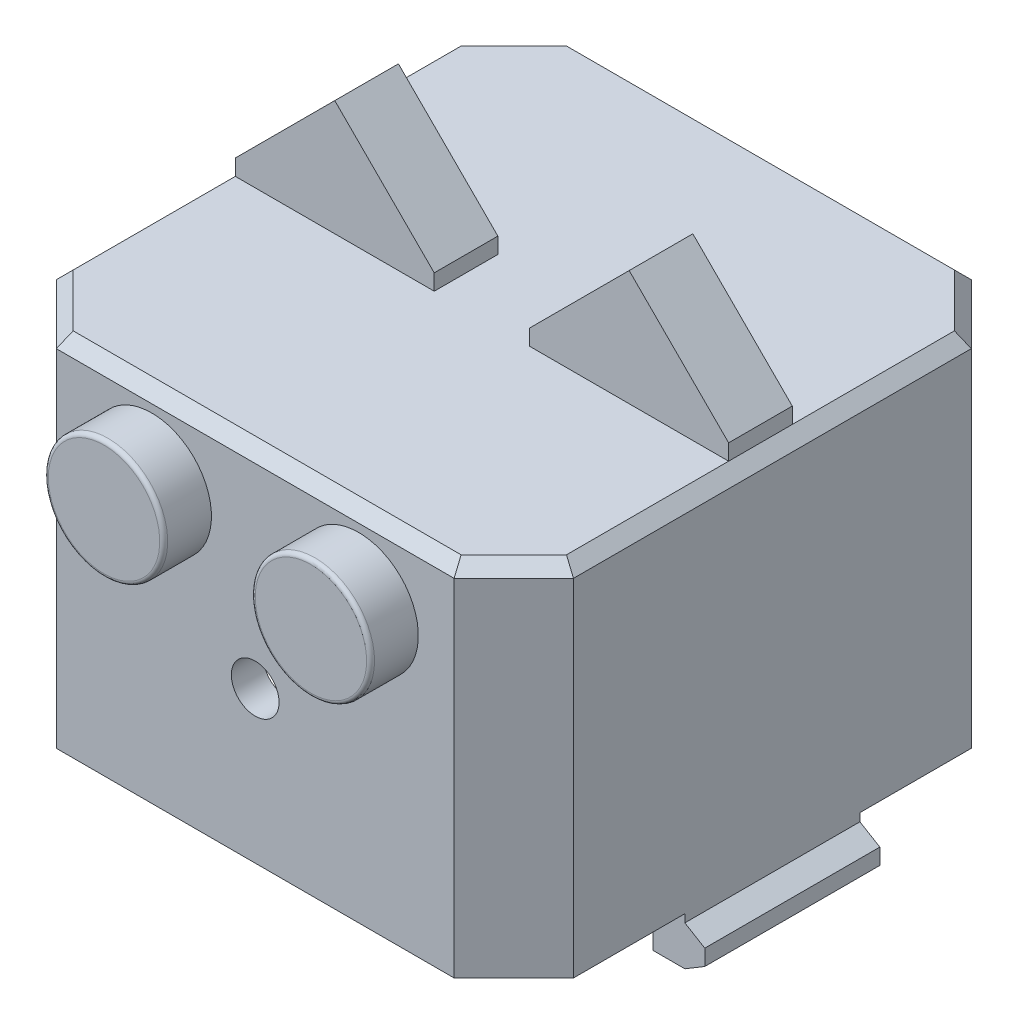
from build123d import *

# Parameters (mm, degrees)
SALIENTE_EXTRUIR1_DEPTH  = 45
VACIADO2_T               = -4
CHAFL_N3_SIZE            = 1.5
CROQUIS2_R               = 7.5
SALIENTE_EXTRUIR2_DEPTH  = 6
CROQUIS4_R               = 5
CORTAR_EXTRUIR2_DEPTH    = 5.5
REDONDEO1_R              = 0.5
CROQUIS5_R               = 3
CORTAR_EXTRUIR3_DEPTH    = 10
SALIENTE_EXTRUIR8_START  = 5.5
CROQUIS13_R              = 5
CROQUIS13_R_2            = 2.6
SALIENTE_EXTRUIR8_DEPTH  = 5.5
CROQUIS7_W               = 4
CROQUIS7_H               = 4
SALIENTE_EXTRUIR3_DEPTH  = 1
CROQUIS8_R               = 2
SALIENTE_EXTRUIR4_DEPTH  = 1
CROQUIS9_R               = 1.6
CORTAR_EXTRUIR5_DEPTH    = 2
CROQUIS10_W              = 25
CROQUIS10_H              = 8
SALIENTE_EXTRUIR5_DEPTH  = 2
SALIENTE_EXTRUIR6_DEPTH  = 8
CROQUIS12_R              = 1.15
CROQUIS12_R_2            = 0.8
SALIENTE_EXTRUIR7_DEPTH  = 6
CROQUIS14_W              = 3
CROQUIS14_H              = 2.5
SALIENTE_EXTRUIR9_DEPTH  = 5
CROQUIS15_W              = 12
CROQUIS15_H              = 8
CORTAR_EXTRUIR6_DEPTH    = 2
CROQUIS16_W              = 14.5
CROQUIS16_H              = 14.5
CROQUIS16_W_2            = 12.4
CROQUIS16_H_2            = 12.4
SALIENTE_EXTRUIR10_DEPTH = 3
CROQUIS17_R              = 5.5
CORTAR_EXTRUIR7_DEPTH    = 96.317889192
CROQUIS18_W              = 4
CROQUIS18_H              = 22
SALIENTE_EXTRUIR11_DEPTH = 6
SALIENTE_EXTRUIR13_DEPTH = 22


with BuildPart() as part:
    # Croquis1 → Saliente-Extruir1 (new body)
    with BuildSketch(Plane(origin=(0, 0, 0), x_dir=(1, 0, 0), z_dir=(0, 1, 0))):
        Polygon((-25, -32.5), (25, -32.5), (32.5, -25), (32.5, 25), (25, 32.5), (-25, 32.5), (-32.5, 25), (-32.5, -25), align=None)
    extrude(amount=SALIENTE_EXTRUIR1_DEPTH)

    # Vaciado2
    vaciado2_openings = [part.faces().sort_by_distance(p)[0] for p in [
        (0, 0, 0),
    ]]
    offset(amount=VACIADO2_T, openings=vaciado2_openings, kind=Kind.INTERSECTION)

    # Chaflán3
    chafl_n3_edges = [part.edges().sort_by_distance(p)[0] for p in [
        (0, 45, -32.5),
        (32.5, 45, 0),
        (0, 45, 32.5),
        (-32.5, 45, 0),
        (-28.75, 45, 28.75),
        (28.75, 45, 28.75),
        (28.75, 45, -28.75),
        (-28.75, 45, -28.75),
    ]]
    chamfer(chafl_n3_edges, length=CHAFL_N3_SIZE)

    # Croquis2 → Saliente-Extruir2 (add)
    with BuildSketch(Plane.XY.offset(32.5)):
        with Locations((13, 35)):
            Circle(CROQUIS2_R)
        with Locations((-13, 35)):
            Circle(CROQUIS2_R)
    extrude(amount=SALIENTE_EXTRUIR2_DEPTH)

    # Croquis4 → Cortar-Extruir2 (cut)
    with BuildSketch(Plane(origin=(0, 0, 28.5), x_dir=(-1, 0, 0), z_dir=(0, 0, -1))):
        with Locations((-13, 35)):
            Circle(CROQUIS4_R)
        with Locations((13, 35)):
            Circle(CROQUIS4_R)
    extrude(amount=-CORTAR_EXTRUIR2_DEPTH, mode=Mode.SUBTRACT)

    # Redondeo1
    redondeo1_edges = [part.edges().sort_by_distance(p)[0] for p in [
        (-20.5, 35, 38.5),
        (5.5, 35, 38.5),
    ]]
    fillet(redondeo1_edges, radius=REDONDEO1_R)

    # Croquis5 → Cortar-Extruir3 (cut)
    with BuildSketch(Plane.XY.offset(32.5)):
        with Locations((0, 19)):
            Circle(CROQUIS5_R)
    extrude(amount=-CORTAR_EXTRUIR3_DEPTH, mode=Mode.SUBTRACT)

    # Croquis13 → Saliente-Extruir8 (add)
    # profile 1 of 2: a face of its own
    with BuildSketch(Plane(origin=(0, 0, 34), x_dir=(-1, 0, 0), z_dir=(0, 0, -1)).offset(SALIENTE_EXTRUIR8_START)):
        with Locations((13, 35)):
            Circle(CROQUIS13_R)
        with Locations((13, 35)):
            Circle(CROQUIS13_R_2, mode=Mode.SUBTRACT)
    # profile 2 of 2: a face of its own
    with BuildSketch(Plane(origin=(0, 0, 34), x_dir=(-1, 0, 0), z_dir=(0, 0, -1)).offset(SALIENTE_EXTRUIR8_START)):
        with Locations((-13, 35)):
            Circle(CROQUIS13_R)
        with Locations((-13, 35)):
            Circle(CROQUIS13_R_2, mode=Mode.SUBTRACT)
    extrude(amount=-SALIENTE_EXTRUIR8_DEPTH)

    # Croquis7 → Saliente-Extruir3 (add)
    with BuildSketch(Plane(origin=(0, 0, 28.5), x_dir=(-1, 0, 0), z_dir=(0, 0, -1))):
        with Locations((-11.58, 10.5)):
            Rectangle(CROQUIS7_W, CROQUIS7_H)
        with Locations((-11.58, 28)):
            Rectangle(CROQUIS7_W, CROQUIS7_H)
        with Locations((11.43, 10.5)):
            Rectangle(CROQUIS7_W, CROQUIS7_H)
        with Locations((11.43, 28)):
            Rectangle(CROQUIS7_W, CROQUIS7_H)
    extrude(amount=SALIENTE_EXTRUIR3_DEPTH)

    # Croquis8 → Saliente-Extruir4 (add)
    with BuildSketch(Plane(origin=(0, 0, 27.5), x_dir=(-1, 0, 0), z_dir=(0, 0, -1))):
        with Locations((-11.505, 10.489346828)):
            Circle(CROQUIS8_R)
        with Locations((-11.505, 27.976317365)):
            Circle(CROQUIS8_R)
        with Locations((11.505, 10.489346828)):
            Circle(CROQUIS8_R)
        with Locations((11.505, 27.976317365)):
            Circle(CROQUIS8_R)
    extrude(amount=SALIENTE_EXTRUIR4_DEPTH)

    # Croquis9 → Cortar-Extruir5 (cut)
    with BuildSketch(Plane(origin=(0, 0, 26.5), x_dir=(-1, 0, 0), z_dir=(0, 0, -1))):
        with Locations((-11.505, 27.976317365)):
            Circle(CROQUIS9_R)
        with Locations((-11.505, 10.489346828)):
            Circle(CROQUIS9_R)
        with Locations((11.505, 10.489346828)):
            Circle(CROQUIS9_R)
        with Locations((11.505, 27.976317365)):
            Circle(CROQUIS9_R)
    extrude(amount=-CORTAR_EXTRUIR5_DEPTH, mode=Mode.SUBTRACT)

    # Croquis10 → Saliente-Extruir5 (add)
    with BuildSketch(Plane(origin=(0, 45, 0), x_dir=(1, 0, 0), z_dir=(0, 1, 0))):
        with Locations((-18.5, 0)):
            Rectangle(CROQUIS10_W, CROQUIS10_H)
        with Locations((18.5, 0)):
            Rectangle(CROQUIS10_W, CROQUIS10_H)
    extrude(amount=SALIENTE_EXTRUIR5_DEPTH)

    # Croquis11 → Saliente-Extruir6 (add)
    with BuildSketch(Plane.XY.offset(4)):
        Polygon((-31, 47), (-6, 47), (-18.5, 59.5), align=None)
        Polygon((31, 47), (18.5, 59.5), (6, 47), align=None)
    extrude(amount=-SALIENTE_EXTRUIR6_DEPTH)

    # Croquis12 → Saliente-Extruir7 (add)
    # profile 1 of 4: a face of its own
    with BuildSketch(Plane.XZ.offset(-41)):
        with Locations((-20.65, 7.68)):
            Circle(CROQUIS12_R)
        with Locations((-20.65, 7.68)):
            Circle(CROQUIS12_R_2, mode=Mode.SUBTRACT)
    # profile 2 of 4: a face of its own
    with BuildSketch(Plane.XZ.offset(-41)):
        with Locations((-20.65, -7.68)):
            Circle(CROQUIS12_R)
        with Locations((-20.65, -7.68)):
            Circle(CROQUIS12_R_2, mode=Mode.SUBTRACT)
    # profile 3 of 4: a face of its own
    with BuildSketch(Plane.XZ.offset(-41)):
        with Locations((20.65, 7.68)):
            Circle(CROQUIS12_R)
        with Locations((20.65, 7.68)):
            Circle(CROQUIS12_R_2, mode=Mode.SUBTRACT)
    # profile 4 of 4: a face of its own
    with BuildSketch(Plane.XZ.offset(-41)):
        with Locations((20.65, -7.68)):
            Circle(CROQUIS12_R)
        with Locations((20.65, -7.68)):
            Circle(CROQUIS12_R_2, mode=Mode.SUBTRACT)
    extrude(amount=SALIENTE_EXTRUIR7_DEPTH)

    # Croquis14 → Saliente-Extruir9 (add)
    with BuildSketch(Plane.XZ.offset(-41)):
        with Locations((-20.65, 7.68)):
            Rectangle(CROQUIS14_W, CROQUIS14_H)
        with Locations((-20.65, -7.68)):
            Rectangle(CROQUIS14_W, CROQUIS14_H)
        with Locations((20.65, 7.68)):
            Rectangle(CROQUIS14_W, CROQUIS14_H)
        with Locations((20.65, -7.68)):
            Rectangle(CROQUIS14_W, CROQUIS14_H)
    extrude(amount=SALIENTE_EXTRUIR9_DEPTH)

    # Croquis15 → Cortar-Extruir6 (cut)
    with BuildSketch(Plane.ZY.offset(32.5)):
        with Locations((0, 36.5)):
            Rectangle(CROQUIS15_W, CROQUIS15_H)
    extrude(amount=-CORTAR_EXTRUIR6_DEPTH, mode=Mode.SUBTRACT)

    # Croquis16 → Saliente-Extruir10 (add)
    with BuildSketch(Plane.XY.offset(-28.5)):
        with Locations((12.75, 12.25)):
            Rectangle(CROQUIS16_W, CROQUIS16_H)
        with Locations((12.75, 12.25)):
            Rectangle(CROQUIS16_W_2, CROQUIS16_H_2, mode=Mode.SUBTRACT)
    extrude(amount=SALIENTE_EXTRUIR10_DEPTH)

    # Croquis17 → Cortar-Extruir7 (cut, through all)
    with BuildSketch(Plane.XY.offset(-28.5)):
        with Locations((12.75, 12.25)):
            Circle(CROQUIS17_R)
    extrude(amount=-CORTAR_EXTRUIR7_DEPTH, mode=Mode.SUBTRACT)

    # Croquis18 → Saliente-Extruir11 (add)
    with BuildSketch(Plane.XZ):
        with Locations((-30.5, 0)):
            Rectangle(CROQUIS18_W, CROQUIS18_H)
        with Locations((30.5, 0)):
            Rectangle(CROQUIS18_W, CROQUIS18_H)
    extrude(amount=SALIENTE_EXTRUIR11_DEPTH)

    # Croquis19 → Saliente-Extruir13 (add)
    with BuildSketch(Plane.XY.offset(11)):
        Polygon((-32.5, -1), (-35, -2.5), (-35, -4.5), (-32.5, -6), align=None)
        Polygon((32.5, -1), (32.5, -6), (35, -4.5), (35, -2.5), align=None)
    extrude(amount=-SALIENTE_EXTRUIR13_DEPTH)


solid = part.part
